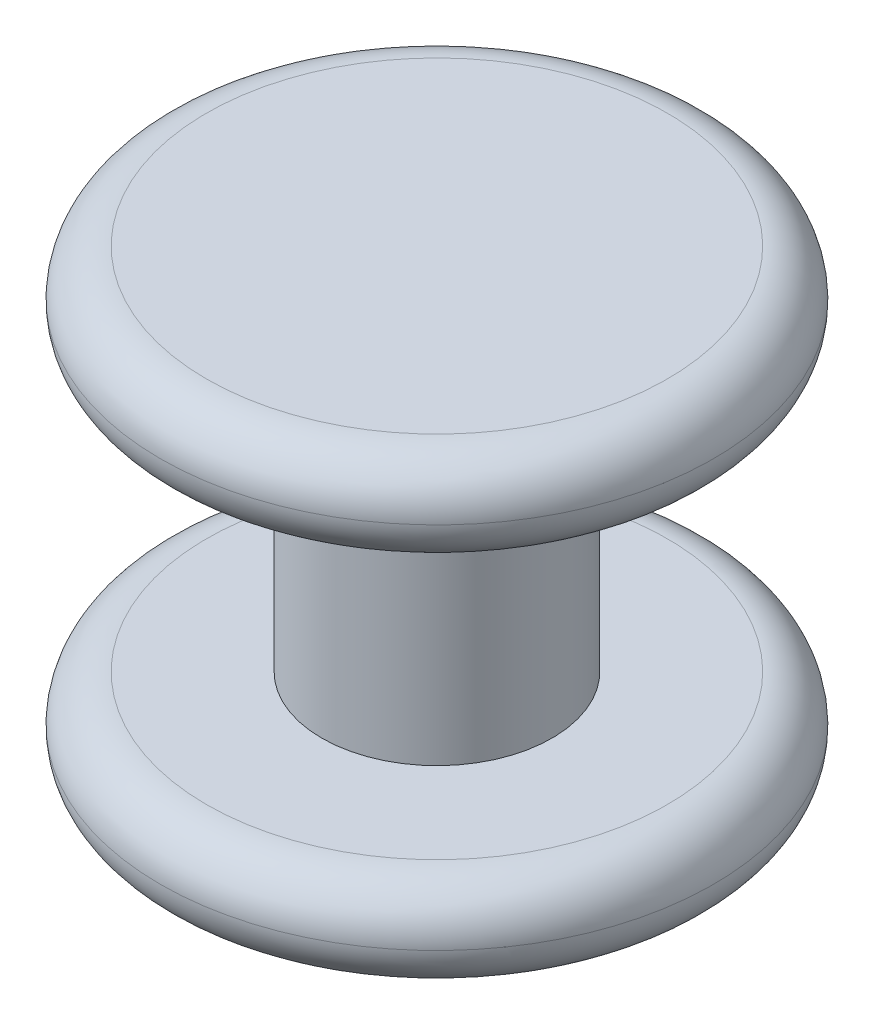
from build123d import *

# Parameters (mm, degrees)
SKETCH1_R           = 2.5
BOSS_EXTRUDE1_DEPTH = 3
SKETCH2_R           = 6
BOSS_EXTRUDE2_DEPTH = 2
FILLET1_R           = 1


with BuildPart() as part:
    # Sketch1 → Boss-Extrude1 (new body)
    with BuildSketch(Plane(origin=(0, 0, 0), x_dir=(1, 0, 0), z_dir=(0, 1, 0))):
        with Locations(Location((0, 0, 0), (0, 0, 270))):
            Circle(SKETCH1_R)
    extrude(amount=BOSS_EXTRUDE1_DEPTH)

    # Sketch2 → Boss-Extrude2 (add)
    with BuildSketch(Plane(origin=(0, 3, 0), x_dir=(1, 0, 0), z_dir=(0, 1, 0))):
        with Locations(Location((0, 0, 0), (0, 0, 270))):
            Circle(SKETCH2_R)
    extrude(amount=BOSS_EXTRUDE2_DEPTH)

    # Fillet1
    fillet1_edges = [part.edges().sort_by_distance(p)[0] for p in [
        (0, 3, -6),
        (0, 5, -6),
    ]]
    fillet(fillet1_edges, radius=FILLET1_R - 0.0001)  # a hair under: the kernel refuses the full size

    # Mirror1: part across plane


with BuildPart() as part_1:
    add(part.part)
    add(part.part.mirror(Plane.ZX))


solid = part_1.part
